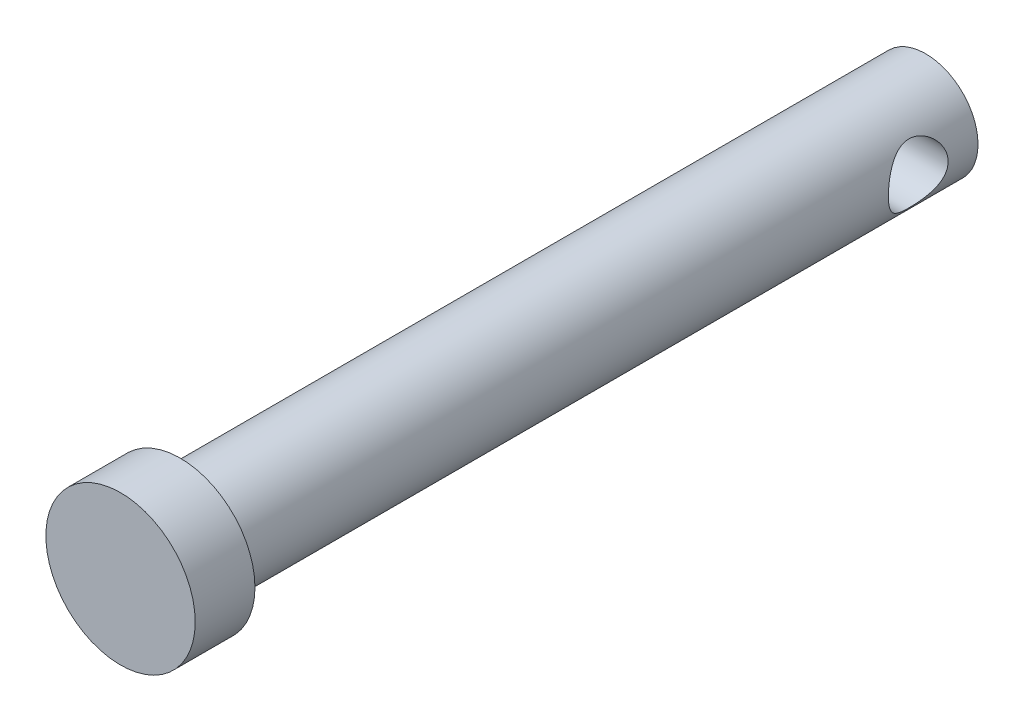
from build123d import *

# Parameters (mm, degrees)
SKETCH1_W               = 125
SKETCH1_H               = 8.75
BOSS_EXTRUDE1_START     = 62.5
BOSS_EXTRUDE1_OUTLINE_R = 12.5
BOSS_EXTRUDE1_DEPTH     = 10
CUT_EXTRUDE1_DEPTH      = 75.705524807
CUT_EXTRUDE1_DEPTH_BACK = 75.705524807
SKETCH2_R               = 5


# Read off the part's stored shape, not the designer's step: Boss-Extrude1
with BuildPart() as part:
    # Sketch1 → Revolve1 (revolve)
    with BuildSketch(Plane(origin=(0, 0, 0), x_dir=(0, 0, -1), z_dir=(1, 0, 0)), mode=Mode.PRIVATE) as revolve1_sk:
        with Locations((0, 4.375)):
            Rectangle(SKETCH1_W, SKETCH1_H)
    revolve(revolve1_sk.sketch.rotate(Axis((0, 0, 0), (0, 0, -1)), 90), axis=Axis((0, 0, 0), (0, 0, -1)))

    # Boss-Extrude1 outline → Boss-Extrude1 (add)
    with BuildSketch(Plane.XY.offset(BOSS_EXTRUDE1_START)):
        with Locations((0.232114028, 0.249851338)):
            Circle(BOSS_EXTRUDE1_OUTLINE_R)
    extrude(amount=BOSS_EXTRUDE1_DEPTH)

    # Sketch2 → Cut-Extrude1 (cut, two sides: drawn at the far end of the back side and taken through both)
    with BuildSketch(Plane(origin=(0, 0, 0), x_dir=(0, 0, -1), z_dir=(1, 0, 0)).offset(-CUT_EXTRUDE1_DEPTH_BACK)):
        with Locations((52.5, 0)):
            Circle(SKETCH2_R)
    extrude(amount=CUT_EXTRUDE1_DEPTH + CUT_EXTRUDE1_DEPTH_BACK, mode=Mode.SUBTRACT)


solid = part.part
